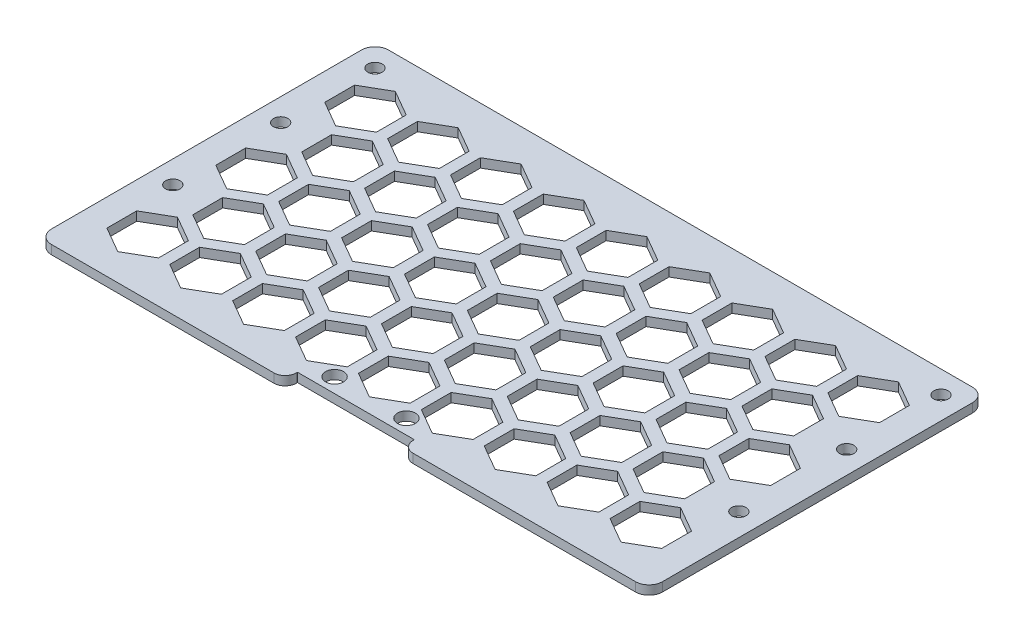
from build123d import *

# Parameters (mm, degrees)
SKETCH_1_W          = 136
SKETCH_1_H          = 78
EXTRUDE_1_DEPTH     = 2
SKETCH_3_W          = 136
SKETCH_3_H          = 3
CUT_EXTRUDE_1_DEPTH = 79.41555968
SKETCH_5_R          = 2
CUT_EXTRUDE_3_DEPTH = 10
SKETCH_6_R          = 1.6
CUT_EXTRUDE_4_DEPTH = 10
SKETCH_8_W          = 26
SKETCH_8_H          = 5.5
CUT_EXTRUDE_6_DEPTH = 79.41555968
FILLET_2_R          = 2.5
FILLET_3_R          = 3
CUT_EXTRUDE_7_DEPTH = 79.41555968
OTHER_1_DEPTH       = 2
SKETCH_10_R         = 1.6
CUT_EXTRUDE_8_DEPTH = 10


# Read off the part's stored shape, not the designer's step: 填充阵列1
with BuildPart() as part:
    # 草图1 → 凸台-拉伸1 (new body)
    with BuildSketch(Plane(origin=(0, 0, 0), x_dir=(1, 0, 0), z_dir=(0, 1, 0))):
        Rectangle(SKETCH_1_W, SKETCH_1_H)
    extrude(amount=EXTRUDE_1_DEPTH)

    # 草图3 → 切除-拉伸1 (cut, through all)
    with BuildSketch(Plane(origin=(0, 2, 0), x_dir=(1, 0, 0), z_dir=(0, 1, 0))):
        with Locations((0, 37.5)):
            Rectangle(SKETCH_3_W, SKETCH_3_H)
    extrude(amount=-CUT_EXTRUDE_1_DEPTH, mode=Mode.SUBTRACT)

    # 草图5 → 切除-拉伸3 (cut)
    with BuildSketch(Plane(origin=(0, 2, 0), x_dir=(1, 0, 0), z_dir=(0, 1, 0))):
        with Locations(Location((-8, -33, 0), (0, 0, 270))):
            Circle(SKETCH_5_R)
        with Locations(Location((8, -33, 0), (0, 0, 270))):
            Circle(SKETCH_5_R)
    extrude(amount=-CUT_EXTRUDE_3_DEPTH, mode=Mode.SUBTRACT)

    # 草图6 → 切除-拉伸4 (cut)
    with BuildSketch(Plane(origin=(0, 2, 0), x_dir=(1, 0, 0), z_dir=(0, 1, 0))):
        with Locations(Location((-63, 31, 0), (0, 0, 270))):
            Circle(SKETCH_6_R)
        with Locations(Location((63, 31, 0), (0, 0, 270))):
            Circle(SKETCH_6_R)
    extrude(amount=-CUT_EXTRUDE_4_DEPTH, mode=Mode.SUBTRACT)

    # 草图8 → 切除-拉伸6 (cut, through all)
    with BuildSketch(Plane(origin=(0, 2, 0), x_dir=(1, 0, 0), z_dir=(0, 1, 0))):
        with Locations((0, -39)):
            Rectangle(SKETCH_8_W, SKETCH_8_H)
    extrude(amount=-CUT_EXTRUDE_6_DEPTH, mode=Mode.SUBTRACT)

    # 圆角2
    fillet_2_edges = [part.edges().sort_by_distance(p)[0] for p in [
        (13, 1, 39),
        (-13, 1, 39),
    ]]
    fillet(fillet_2_edges, radius=FILLET_2_R)

    # 圆角3
    fillet_3_edges = [part.edges().sort_by_distance(p)[0] for p in [
        (68, 1, -36),
        (-68, 1, -36),
        (68, 1, 39),
        (-68, 1, 39),
    ]]
    fillet(fillet_3_edges, radius=FILLET_3_R)

    # 草图9 → 切除-拉伸7 (cut, through all)
    with BuildSketch(Plane(origin=(0, 2, 0), x_dir=(1, 0, 0), z_dir=(0, 1, 0))):
        Polygon((-56.25, -33), (-50.5, -29.680235952), (-50.5, -23.040707856), (-56.25, -19.720943809), (-62, -23.040707856), (-62, -29.680235952), align=None)
    extrude(amount=-CUT_EXTRUDE_7_DEPTH, mode=Mode.SUBTRACT)

    # 填充阵列1 outline → 填充阵列1 (cut)
    with BuildSketch(Plane(origin=(0, 0, 0), x_dir=(1, 0, 0), z_dir=(0, 1, 0))):
        Polygon((-7.25, 16.65212315), (-13, 13.332359102), (-13, 6.692831007), (-7.25, 3.373066959), (-1.5, 6.692831007), (-1.5, 13.332359102), align=None)
        Polygon((-7.25, -7.596588156), (-13, -10.916352203), (-13, -17.555880299), (-7.25, -20.875644347), (-1.5, -17.555880299), (-1.5, -10.916352203), align=None)
        Polygon((-56.25, 28.776478803), (-62, 25.456714755), (-62, 18.81718666), (-56.25, 15.497422612), (-50.5, 18.81718666), (-50.5, 25.456714755), align=None)
        Polygon((-56.25, 4.527767497), (-62, 1.208003449), (-62, -5.431524646), (-56.25, -8.751288694), (-50.5, -5.431524646), (-50.5, 1.208003449), align=None)
        Polygon((-29.5, -10.916352203), (-35.25, -7.596588156), (-41, -10.916352203), (-41, -17.555880299), (-35.25, -20.875644347), (-29.5, -17.555880299), align=None)
        Polygon((-8.5, 1.208003449), (-14.25, 4.527767497), (-20, 1.208003449), (-20, -5.431524646), (-14.25, -8.751288694), (-8.5, -5.431524646), align=None)
        Polygon((33.5, 25.456714755), (27.75, 28.776478803), (22, 25.456714755), (22, 18.81718666), (27.75, 15.497422612), (33.5, 18.81718666), align=None)
        Polygon((12.5, 13.332359102), (6.75, 16.65212315), (1, 13.332359102), (1, 6.692831007), (6.75, 3.373066959), (12.5, 6.692831007), align=None)
        Polygon((33.5, -29.680235952), (33.5, -23.040707856), (27.75, -19.720943809), (22, -23.040707856), (22, -29.680235952), (27.75, -33), align=None)
        Polygon((-29.5, 6.692831007), (-29.5, 13.332359102), (-35.25, 16.65212315), (-41, 13.332359102), (-41, 6.692831007), (-35.25, 3.373066959), align=None)
        Polygon((12.5, -17.555880299), (12.5, -10.916352203), (6.75, -7.596588156), (1, -10.916352203), (1, -17.555880299), (6.75, -20.875644347), align=None)
        Polygon((55.75, 28.776478803), (50, 25.456714755), (50, 18.81718666), (55.75, 15.497422612), (61.5, 18.81718666), (61.5, 25.456714755), align=None)
        Polygon((55.75, 4.527767497), (50, 1.208003449), (50, -5.431524646), (55.75, -8.751288694), (61.5, -5.431524646), (61.5, 1.208003449), align=None)
        Polygon((55.75, -19.720943809), (50, -23.040707856), (50, -29.680235952), (55.75, -33), (61.5, -29.680235952), (61.5, -23.040707856), align=None)
        Polygon((-22.5, -23.040707856), (-28.25, -19.720943809), (-34, -23.040707856), (-34, -29.680235952), (-28.25, -33), (-22.5, -29.680235952), align=None)
        Polygon((19.5, 1.208003449), (13.75, 4.527767497), (8, 1.208003449), (8, -5.431524646), (13.75, -8.751288694), (19.5, -5.431524646), align=None)
        Polygon((40.5, 13.332359102), (34.75, 16.65212315), (29, 13.332359102), (29, 6.692831007), (34.75, 3.373066959), (40.5, 6.692831007), align=None)
        Polygon((41.75, -19.720943809), (36, -23.040707856), (36, -29.680235952), (41.75, -33), (47.5, -29.680235952), (47.5, -23.040707856), align=None)
        Polygon((41.75, 4.527767497), (36, 1.208003449), (36, -5.431524646), (41.75, -8.751288694), (47.5, -5.431524646), (47.5, 1.208003449), align=None)
        Polygon((41.75, 28.776478803), (36, 25.456714755), (36, 18.81718666), (41.75, 15.497422612), (47.5, 18.81718666), (47.5, 25.456714755), align=None)
        Polygon((-15.5, 6.692831007), (-15.5, 13.332359102), (-21.25, 16.65212315), (-27, 13.332359102), (-27, 6.692831007), (-21.25, 3.373066959), align=None)
        Polygon((-36.5, 18.81718666), (-36.5, 25.456714755), (-42.25, 28.776478803), (-48, 25.456714755), (-48, 18.81718666), (-42.25, 15.497422612), align=None)
        Polygon((26.5, -17.555880299), (26.5, -10.916352203), (20.75, -7.596588156), (15, -10.916352203), (15, -17.555880299), (20.75, -20.875644347), align=None)
        Polygon((5.5, -5.431524646), (5.5, 1.208003449), (-0.25, 4.527767497), (-6, 1.208003449), (-6, -5.431524646), (-0.25, -8.751288694), align=None)
        Polygon((40.5, -10.916352203), (34.75, -7.596588156), (29, -10.916352203), (29, -17.555880299), (34.75, -20.875644347), (40.5, -17.555880299), align=None)
        Polygon((19.5, -23.040707856), (13.75, -19.720943809), (8, -23.040707856), (8, -29.680235952), (13.75, -33), (19.5, -29.680235952), align=None)
        Polygon((19.5, 18.81718666), (19.5, 25.456714755), (13.75, 28.776478803), (8, 25.456714755), (8, 18.81718666), (13.75, 15.497422612), align=None)
        Polygon((48.75, -7.596588156), (43, -10.916352203), (43, -17.555880299), (48.75, -20.875644347), (54.5, -17.555880299), (54.5, -10.916352203), align=None)
        Polygon((48.75, 16.65212315), (43, 13.332359102), (43, 6.692831007), (48.75, 3.373066959), (54.5, 6.692831007), (54.5, 13.332359102), align=None)
        Polygon((-8.5, 18.81718666), (-8.5, 25.456714755), (-14.25, 28.776478803), (-20, 25.456714755), (-20, 18.81718666), (-14.25, 15.497422612), align=None)
        Polygon((33.5, -5.431524646), (33.5, 1.208003449), (27.75, 4.527767497), (22, 1.208003449), (22, -5.431524646), (27.75, -8.751288694), align=None)
        Polygon((-22.5, 18.81718666), (-22.5, 25.456714755), (-28.25, 28.776478803), (-34, 25.456714755), (-34, 18.81718666), (-28.25, 15.497422612), align=None)
        Polygon((-8.5, -23.040707856), (-14.25, -19.720943809), (-20, -23.040707856), (-20, -29.680235952), (-14.25, -33), (-8.5, -29.680235952), align=None)
        Polygon((5.5, -23.040707856), (-0.25, -19.720943809), (-6, -23.040707856), (-6, -29.680235952), (-0.25, -33), (5.5, -29.680235952), align=None)
        Polygon((26.5, 6.692831007), (26.5, 13.332359102), (20.75, 16.65212315), (15, 13.332359102), (15, 6.692831007), (20.75, 3.373066959), align=None)
        Polygon((5.5, 18.81718666), (5.5, 25.456714755), (-0.25, 28.776478803), (-6, 25.456714755), (-6, 18.81718666), (-0.25, 15.497422612), align=None)
        Polygon((-21.25, -7.596588156), (-27, -10.916352203), (-27, -17.555880299), (-21.25, -20.875644347), (-15.5, -17.555880299), (-15.5, -10.916352203), align=None)
        Polygon((-36.5, 1.208003449), (-42.25, 4.527767497), (-48, 1.208003449), (-48, -5.431524646), (-42.25, -8.751288694), (-36.5, -5.431524646), align=None)
        Polygon((-28.25, 4.527767497), (-34, 1.208003449), (-34, -5.431524646), (-28.25, -8.751288694), (-22.5, -5.431524646), (-22.5, 1.208003449), align=None)
        Polygon((-43.5, -10.916352203), (-49.25, -7.596588156), (-55, -10.916352203), (-55, -17.555880299), (-49.25, -20.875644347), (-43.5, -17.555880299), align=None)
        Polygon((-43.5, 6.692831007), (-43.5, 13.332359102), (-49.25, 16.65212315), (-55, 13.332359102), (-55, 6.692831007), (-49.25, 3.373066959), align=None)
        Polygon((-36.5, -23.040707856), (-42.25, -19.720943809), (-48, -23.040707856), (-48, -29.680235952), (-42.25, -33), (-36.5, -29.680235952), align=None)
    extrude(amount=OTHER_1_DEPTH, mode=Mode.SUBTRACT)

    # 草图10 → 切除-拉伸8 (cut)
    with BuildSketch(Plane(origin=(0, 2, 0), x_dir=(1, 0, 0), z_dir=(0, 1, 0))):
        with Locations(Location((-63, 10, 0), (0, 0, 270))):
            Circle(SKETCH_10_R)
        with Locations(Location((-63, -14, 0), (0, 0, 270))):
            Circle(SKETCH_10_R)
        with Locations(Location((63, 10, 0), (0, 0, 270))):
            Circle(SKETCH_10_R)
        with Locations(Location((63, -14, 0), (0, 0, 270))):
            Circle(SKETCH_10_R)
        with Locations(Location((-63, 31, 0), (0, 0, 270))):
            Circle(SKETCH_10_R)
        with Locations(Location((63, 31, 0), (0, 0, 270))):
            Circle(SKETCH_10_R)
    extrude(amount=-CUT_EXTRUDE_8_DEPTH, mode=Mode.SUBTRACT)


solid = part.part
